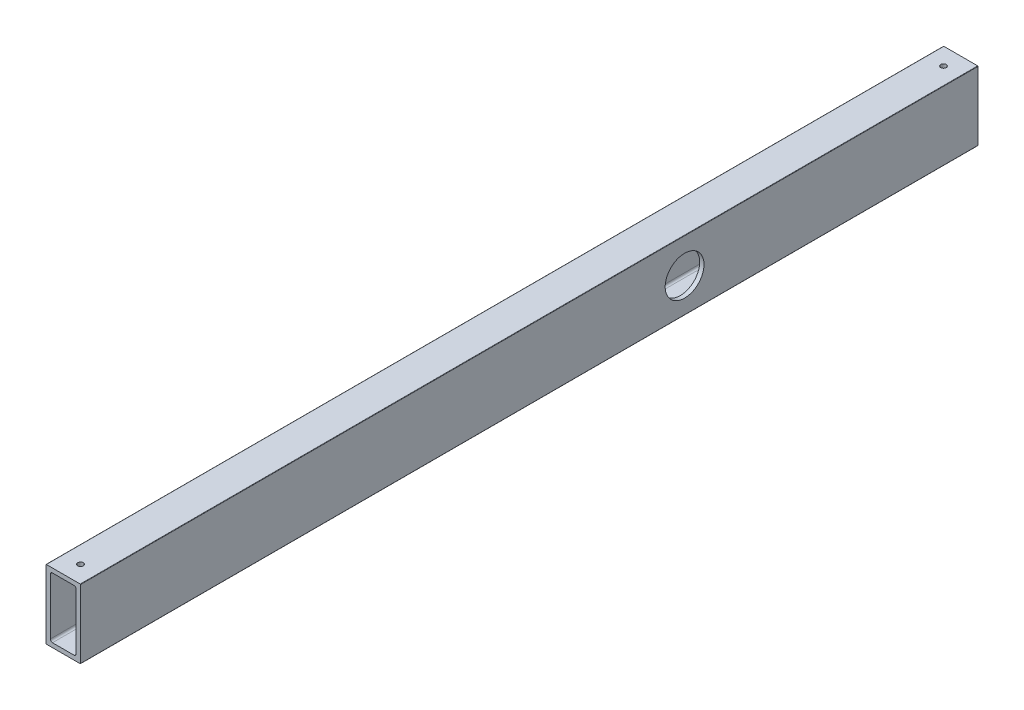
from build123d import *

# Parameters (mm, degrees)
BOSS_EXTRUDE1_DEPTH = 660.4
SKETCH2_R           = 2.032
CUT_EXTRUDE1_DEPTH  = 663.837808216
SKETCH5_R           = 14.2875
CUT_EXTRUDE2_DEPTH  = 663.837808216


with BuildPart() as part:
    # Sketch1 → Boss-Extrude1 (new body)
    with BuildSketch(Plane(origin=(0, 0, 0), x_dir=(-1, 0, 0), z_dir=(0, 0, -1))):
        with BuildLine():
            Line((0, 0.254), (0, 50.546))
            ThreePointArc((0, 50.546), (-0.074394878, 50.725605122), (-0.254, 50.8))
            Line((-0.254, 50.8), (-25.146, 50.8))
            ThreePointArc((-25.146, 50.8), (-25.325605122, 50.725605122), (-25.4, 50.546))
            Line((-25.4, 50.546), (-25.4, 0.254))
            ThreePointArc((-25.4, 0.254), (-25.325605122, 0.074394878), (-25.146, 0))
            Line((-25.146, 0), (-0.254, 0))
            ThreePointArc((-0.254, 0), (-0.074394878, 0.074394878), (0, 0.254))
        make_face()
        with BuildLine():
            Line((-3.175, 46.0375), (-3.175, 4.7625))
            ThreePointArc((-3.175, 4.7625), (-3.639967985, 3.639967985), (-4.7625, 3.175))
            Line((-4.7625, 3.175), (-20.6375, 3.175))
            ThreePointArc((-20.6375, 3.175), (-21.760032015, 3.639967985), (-22.225, 4.7625))
            Line((-22.225, 4.7625), (-22.225, 46.0375))
            ThreePointArc((-22.225, 46.0375), (-21.760032015, 47.160032015), (-20.6375, 47.625))
            Line((-20.6375, 47.625), (-4.7625, 47.625))
            ThreePointArc((-4.7625, 47.625), (-3.639967985, 47.160032015), (-3.175, 46.0375))
        make_face(mode=Mode.SUBTRACT)
    extrude(amount=-BOSS_EXTRUDE1_DEPTH)

    # Sketch2 → Cut-Extrude1 (cut, through all)
    with BuildSketch(Plane(origin=(0, 50.8, 0), x_dir=(1, 0, 0), z_dir=(0, 1, 0))):
        with Locations((12.7, -647.7)):
            Circle(SKETCH2_R)
        with Locations((12.7, -673.1)):
            Circle(SKETCH2_R)
        with Locations((12.7, 12.7)):
            Circle(SKETCH2_R)
        with Locations((12.7, -12.7)):
            Circle(SKETCH2_R)
    extrude(amount=-CUT_EXTRUDE1_DEPTH, mode=Mode.SUBTRACT)

    # Sketch5 → Cut-Extrude2 (cut, through all)
    with BuildSketch(Plane(origin=(25.4, 0, 0), x_dir=(0, 0, -1), z_dir=(1, 0, 0))):
        with Locations((-215.9, 25.146)):
            Circle(SKETCH5_R)
    extrude(amount=-CUT_EXTRUDE2_DEPTH, mode=Mode.SUBTRACT)


solid = part.part
